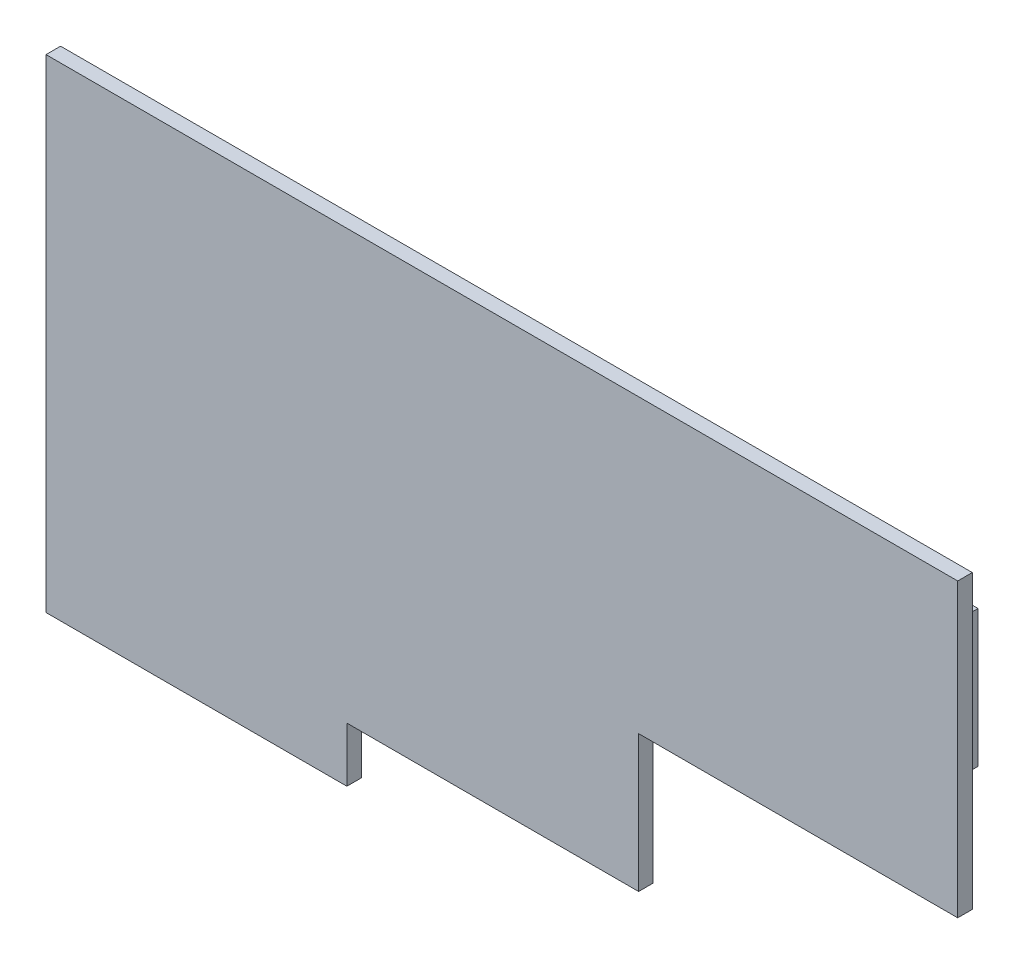
from build123d import *

# Parameters (mm, degrees)
BOSS_EXTRUDE1_DEPTH = 1.6
SKETCH2_W           = 5
SKETCH2_H           = 15
BOSS_EXTRUDE2_DEPTH = 7


with BuildPart() as part:
    # Sketch1 → Boss-Extrude1 (new body)
    with BuildSketch(Plane.XY):
        Polygon((33, -53), (33, -47), (65, -47), (65, -32), (100, -32), (100, 0), (65, 0), (33, 0), (0, 0), (0, -53), align=None)
    extrude(amount=BOSS_EXTRUDE1_DEPTH)

    # Sketch2 → Boss-Extrude2 (add)
    with BuildSketch(Plane(origin=(0, 0, 0), x_dir=(-1, 0, 0), z_dir=(0, 0, -1))):
        with Locations((-91.125, -17.6)):
            Rectangle(SKETCH2_W, SKETCH2_H)
    extrude(amount=BOSS_EXTRUDE2_DEPTH)


solid = part.part
